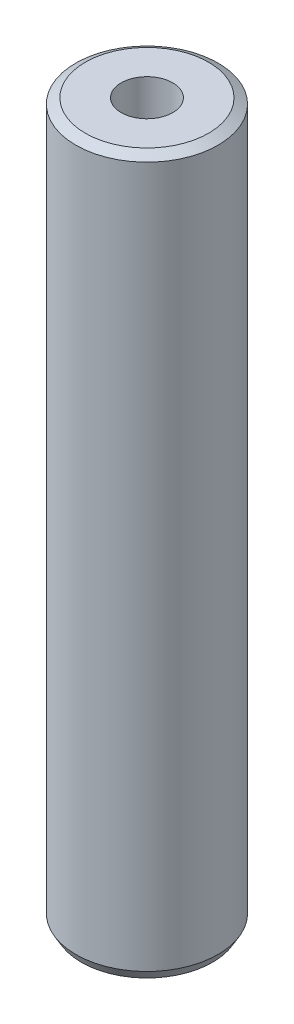
from build123d import *
from OCP.BRepFilletAPI import BRepFilletAPI_MakeChamfer

# Parameters (mm, degrees)
SKETCH1_R           = 57.5
BOSS_EXTRUDE1_DEPTH = 578.496611432
SKETCH2_R           = 20.858066381
CUT_EXTRUDE1_DEPTH  = 585.183900359
CHAMFER1_SIZE       = 4.465449774
CHAMFER1_SIZE2      = 7.734385887


with BuildPart() as part:
    # Sketch1 → Boss-Extrude1 (new body)
    with BuildSketch(Plane(origin=(0, 0, 0), x_dir=(1, 0, 0), z_dir=(0, 1, 0))):
        Circle(SKETCH1_R)
    extrude(amount=BOSS_EXTRUDE1_DEPTH)

    # Sketch2 → Cut-Extrude1 (cut, through all)
    with BuildSketch(Plane(origin=(0, 0, 0), x_dir=(1, 0, 0), z_dir=(0, 1, 0))):
        Circle(SKETCH2_R)
    extrude(amount=CUT_EXTRUDE1_DEPTH, mode=Mode.SUBTRACT)

    # Chamfer1: one chamfer whose edges measure the first distance from different faces: ONE call of the kernel's chamfer builder (chamfer() names one face for all edges)
    chamfer1_edges_1 = [part.edges().sort_by_distance(p)[0] for p in [
        (-57.5, 578.496611432, 0),
    ]]
    chamfer1_side_1 = [part.faces().sort_by_distance(p)[0] for p in [
        (-57.5, 289.248305716, 0),
    ]]
    chamfer1_edges_2 = [part.edges().sort_by_distance(p)[0] for p in [
        (-57.5, 0, 0),
    ]]
    chamfer1_side_2 = [part.faces().sort_by_distance(p)[0] for p in [
        (-55.873654403, 0, 0),
    ]]
    chamfer1 = BRepFilletAPI_MakeChamfer(part.part.solid().wrapped)
    for e in chamfer1_edges_1:
        chamfer1.Add(CHAMFER1_SIZE, CHAMFER1_SIZE2, e.wrapped, chamfer1_side_1[0].wrapped)  # the first distance lies on this face
    for e in chamfer1_edges_2:
        chamfer1.Add(CHAMFER1_SIZE, CHAMFER1_SIZE2, e.wrapped, chamfer1_side_2[0].wrapped)  # the first distance lies on this face
    add(Compound.cast(chamfer1.Shape()), mode=Mode.REPLACE)


solid = part.part
